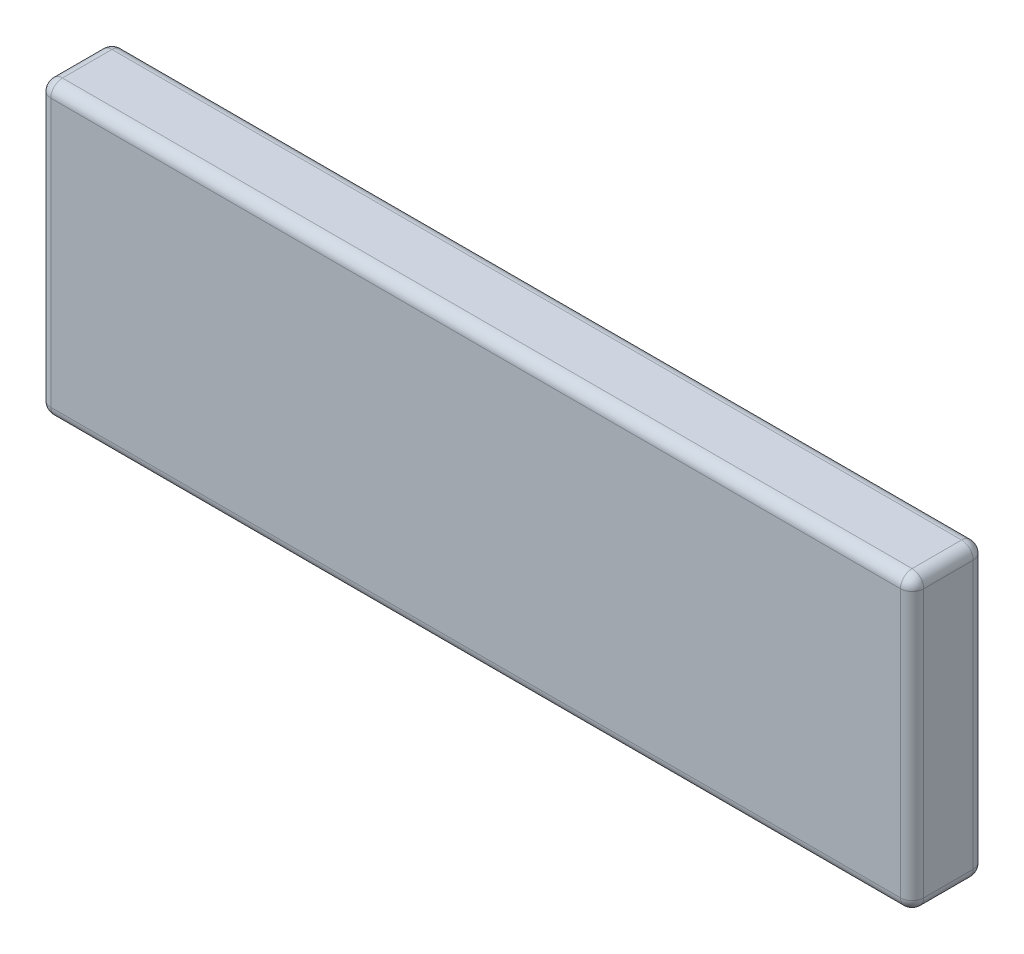
from build123d import *

# Parameters (mm, degrees)
SKETCH1_W           = 19.05
SKETCH1_H           = 6.35
BOSS_EXTRUDE1_DEPTH = 1.5875
FILLET1_R           = 0.254


with BuildPart() as part:
    # Sketch1 → Boss-Extrude1 (new body)
    with BuildSketch(Plane.XY):
        Rectangle(SKETCH1_W, SKETCH1_H)
    extrude(amount=BOSS_EXTRUDE1_DEPTH)

    # Fillet1
    fillet1_edges = [part.edges().sort_by_distance(p)[0] for p in [
        (-9.525, 0, 1.5875),
        (-9.525, 0, 0),
        (-9.525, -3.175, 0.79375),
        (0, -3.175, 1.5875),
        (0, -3.175, 0),
        (9.525, -3.175, 0.79375),
        (9.525, 0, 1.5875),
        (9.525, 0, 0),
        (9.525, 3.175, 0.79375),
        (0, 3.175, 1.5875),
        (-9.525, 3.175, 0.79375),
        (0, 3.175, 0),
    ]]
    fillet(fillet1_edges, radius=FILLET1_R)


solid = part.part
